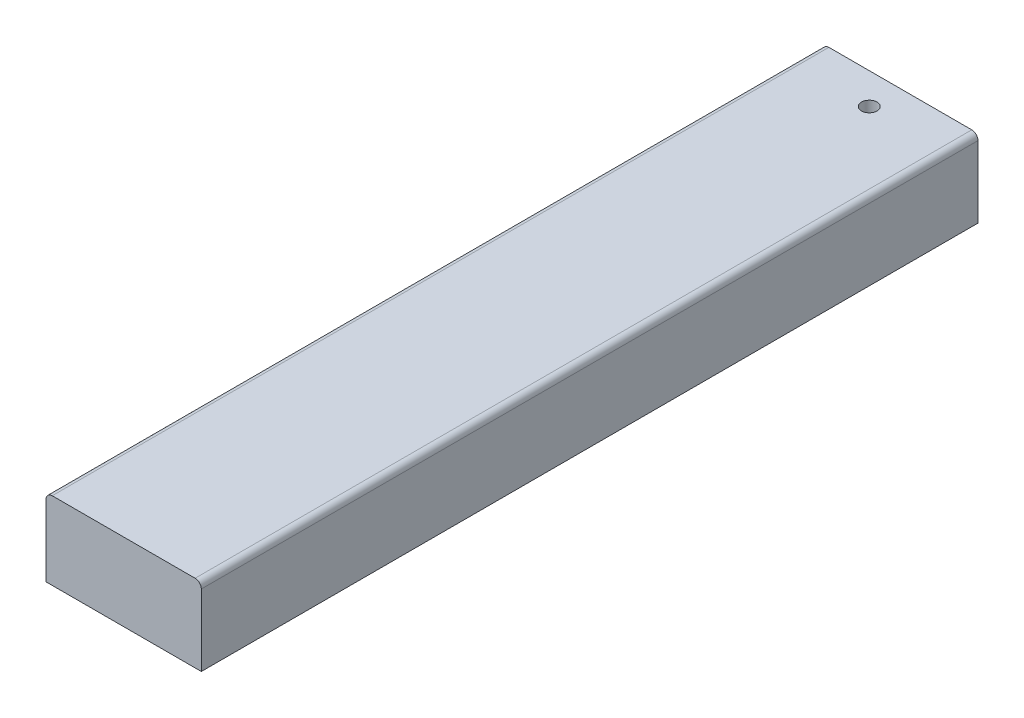
from build123d import *

# Parameters (mm, degrees)
SKETCH1_W               = 50
SKETCH1_H               = 20
BOSS_EXTRUDE1_DEPTH     = 125
SKETCH3_W               = 50
SKETCH3_H               = 250
BOSS_EXTRUDE2_DEPTH     = 5
CUT_EXTRUDE1_DEPTH      = 130.903810568
CUT_EXTRUDE1_DEPTH_BACK = 10
SKETCH2_R               = 2.5
FILLET1_R               = 2
SKETCH4_R               = 7.874
CUT_EXTRUDE2_DEPTH      = 5


with BuildPart() as part:
    # Sketch1 → Boss-Extrude1 (new, symmetric)
    with BuildSketch(Plane.XY):
        Rectangle(SKETCH1_W, SKETCH1_H)
    extrude(amount=BOSS_EXTRUDE1_DEPTH, both=True)

    # Sketch3 → Boss-Extrude2 (add)
    with BuildSketch(Plane(origin=(0, 10, 0), x_dir=(1, 0, 0), z_dir=(0, 1, 0))):
        Rectangle(SKETCH3_W, SKETCH3_H)
    extrude(amount=BOSS_EXTRUDE2_DEPTH)

    # Sketch2 → Cut-Extrude1 (cut, two sides: drawn at the far end of the back side and taken through both)
    with BuildSketch(Plane(origin=(0, 15, 0), x_dir=(1, 0, 0), z_dir=(0, 1, 0)).offset(-CUT_EXTRUDE1_DEPTH_BACK)):
        with Locations((0, 115)):
            Circle(SKETCH2_R)
    extrude(amount=CUT_EXTRUDE1_DEPTH + CUT_EXTRUDE1_DEPTH_BACK, mode=Mode.SUBTRACT)

    # Fillet1
    fillet1_edges = [part.edges().sort_by_distance(p)[0] for p in [
        (-25, 15, 0),
        (25, 15, 0),
    ]]
    fillet(fillet1_edges, radius=FILLET1_R)

    # Sketch4 → Cut-Extrude2 (cut)
    with BuildSketch(Plane.XZ.offset(10)):
        with Locations((0, 110)):
            Circle(SKETCH4_R)
    extrude(amount=-CUT_EXTRUDE2_DEPTH, mode=Mode.SUBTRACT)


solid = part.part
